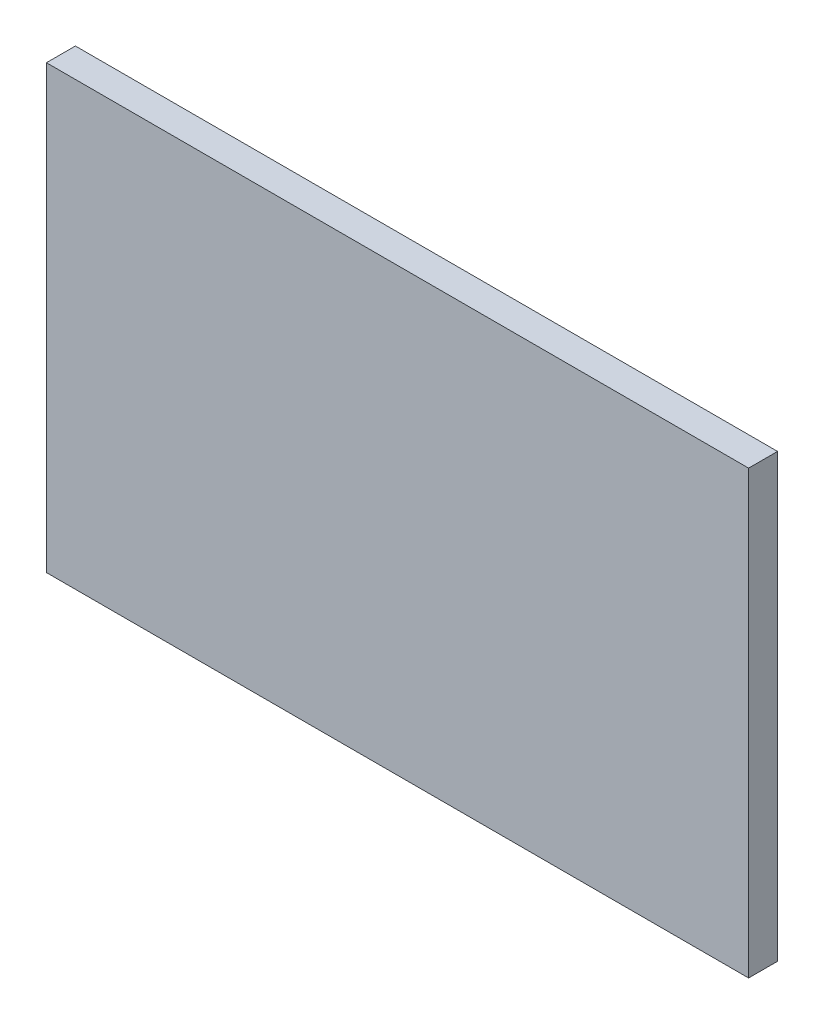
from build123d import *

# Parameters (mm, degrees)
BOSS_EXTRUDE1_DEPTH = 12.7


with BuildPart() as part:
    # Sketch1 → Boss-Extrude1 (new body)
    with BuildSketch(Plane.XY):
        Polygon((155.575, -88.9), (-152.4, -88.9), (-152.4, 0), (-152.4, 104.775), (155.575, 104.775), (155.575, 0), align=None)
    extrude(amount=BOSS_EXTRUDE1_DEPTH)


solid = part.part
